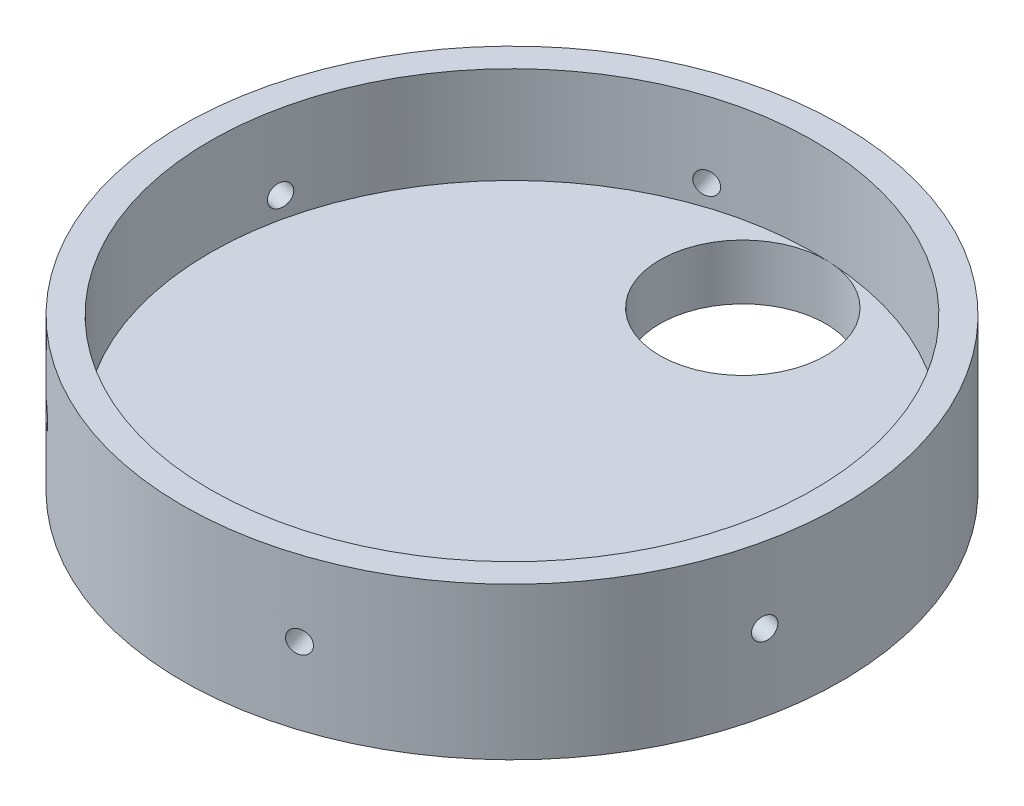
from build123d import *

# Parameters (mm, degrees)
SKETCH1_R                            = 75.692
SKETCH1_R_2                          = 69.342
BOSS_EXTRUDE1_DEPTH                  = 22.225
BOSS_EXTRUDE2_START                  = 12.7
SKETCH2_R                            = 75.692
BOSS_EXTRUDE2_DEPTH                  = 12.7
TAP_DRILL_FOR_1_4_20_TAP1_AT_2_COUNT = 2
TAP_DRILL_FOR_1_4_20_TAP1_AT_2_PITCH = 53.488399339
CIRPATTERN1_COUNT                    = 6
SKETCH5_R                            = 19.05
CUT_EXTRUDE1_DEPTH                   = 110.327528042


with BuildPart() as part:
    # Sketch1 → Boss-Extrude1 (new body)
    with BuildSketch(Plane(origin=(0, 0, 0), x_dir=(1, 0, 0), z_dir=(0, 1, 0))):
        Circle(SKETCH1_R)
        Circle(SKETCH1_R_2, mode=Mode.SUBTRACT)
    extrude(amount=BOSS_EXTRUDE1_DEPTH)

    # Sketch2 → Boss-Extrude2 (add)
    with BuildSketch(Plane.XZ.offset(BOSS_EXTRUDE2_START)):
        Circle(SKETCH2_R)
    extrude(amount=-BOSS_EXTRUDE2_DEPTH)

    # Sketch4 → Tap Drill for 1/4-20 Tap1 (revolve, cut)
    with BuildSketch(Plane(origin=(73.997176623, 4.896298223, 15.927859738), x_dir=(0.21042989666546502, 0, -0.9776089497285517), z_dir=(0, 1, 0))):
        Polygon((0, 0), (0, 11.185816902), (2.5527, 9.652), (2.5527, 0), align=None)
    tap_drill_for_1_4_20_tap1 = revolve(axis=Axis((80.204993454, 4.896298223, 17.264089582), (-0.9776089497285516, 0, -0.210429896665465)), mode=Mode.SUBTRACT)

    # Tap Drill for 1/4-20 Tap1 at 2: Tap Drill for 1/4-20 Tap1 ×2
    with Locations(*[Vector(-0.1104385806360645, 0.8512109993044242, 0.5130722703189632) * (i * TAP_DRILL_FOR_1_4_20_TAP1_AT_2_PITCH) for i in range(1, TAP_DRILL_FOR_1_4_20_TAP1_AT_2_COUNT)]):
        add(tap_drill_for_1_4_20_tap1, mode=Mode.SUBTRACT)

    # CirPattern1: Tap Drill for 1/4-20 Tap1 ×6 about axis
    cirpattern1_axis = Axis((0, 22.225, 0), (0, -1, 0))
    for i in range(1, CIRPATTERN1_COUNT):
        add(tap_drill_for_1_4_20_tap1.rotate(cirpattern1_axis, i * 360 / CIRPATTERN1_COUNT), mode=Mode.SUBTRACT)

    # CirPattern1 copy 1 sketch → CirPattern1 copy 1 (revolve, cut)
    with BuildSketch(Plane(origin=(-3.515628412, 50.426212075, 80.653301416), x_dir=(0.9518491337646824, 0, -0.30656683863624895), z_dir=(0, 1, 0))):
        Polygon((0, 0), (0, 11.185816902), (2.5527, 9.652), (2.5527, 0), align=None)
    revolve(axis=Axis((-1.568928987, 50.426212075, 86.697543415), (-0.3065668386362489, 0, -0.9518491337646823)), mode=Mode.SUBTRACT)

    # CirPattern1 copy 2 sketch → CirPattern1 copy 2 (revolve, cut)
    with BuildSketch(Plane(origin=(-71.605622131, 50.426212075, 37.282027193), x_dir=(0.7414192370992175, 0, 0.6710421110923027), z_dir=(0, 1, 0))):
        Polygon((0, 0), (0, 11.185816902), (2.5527, 9.652), (2.5527, 0), align=None)
    revolve(axis=Axis((-75.866739537, 50.426212075, 41.990039348), (0.6710421110923026, 0, -0.7414192370992174)), mode=Mode.SUBTRACT)

    # CirPattern1 copy 3 sketch → CirPattern1 copy 3 (revolve, cut)
    with BuildSketch(Plane(origin=(-68.089993719, 50.426212075, -43.371274223), x_dir=(-0.2104298966654649, 0, 0.9776089497285517), z_dir=(0, 1, 0))):
        Polygon((0, 0), (0, 11.185816902), (2.5527, 9.652), (2.5527, 0), align=None)
    revolve(axis=Axis((-74.29781055, 50.426212075, -44.707504067), (0.9776089497285516, 0, 0.21042989666546488)), mode=Mode.SUBTRACT)

    # CirPattern1 copy 4 sketch → CirPattern1 copy 4 (revolve, cut)
    with BuildSketch(Plane(origin=(3.515628412, 50.426212075, -80.653301416), x_dir=(-0.9518491337646823, 0, 0.30656683863624934), z_dir=(0, 1, 0))):
        Polygon((0, 0), (0, 11.185816902), (2.5527, 9.652), (2.5527, 0), align=None)
    revolve(axis=Axis((1.568928987, 50.426212075, -86.697543415), (0.3065668386362493, 0, 0.9518491337646823)), mode=Mode.SUBTRACT)

    # CirPattern1 copy 5 sketch → CirPattern1 copy 5 (revolve, cut)
    with BuildSketch(Plane(origin=(71.605622131, 50.426212075, -37.282027193), x_dir=(-0.7414192370992174, 0, -0.671042111092303), z_dir=(0, 1, 0))):
        Polygon((0, 0), (0, 11.185816902), (2.5527, 9.652), (2.5527, 0), align=None)
    revolve(axis=Axis((75.866739537, 50.426212075, -41.990039348), (-0.6710421110923029, 0, 0.7414192370992173)), mode=Mode.SUBTRACT)

    # Sketch5 → Cut-Extrude1 (cut, through all)
    with BuildSketch(Plane(origin=(0, 0, 0), x_dir=(1, 0, 0), z_dir=(0, 1, 0))):
        with Locations((2.796206622, 50.214206083)):
            Circle(SKETCH5_R)
    extrude(amount=-CUT_EXTRUDE1_DEPTH, mode=Mode.SUBTRACT)


solid = part.part
